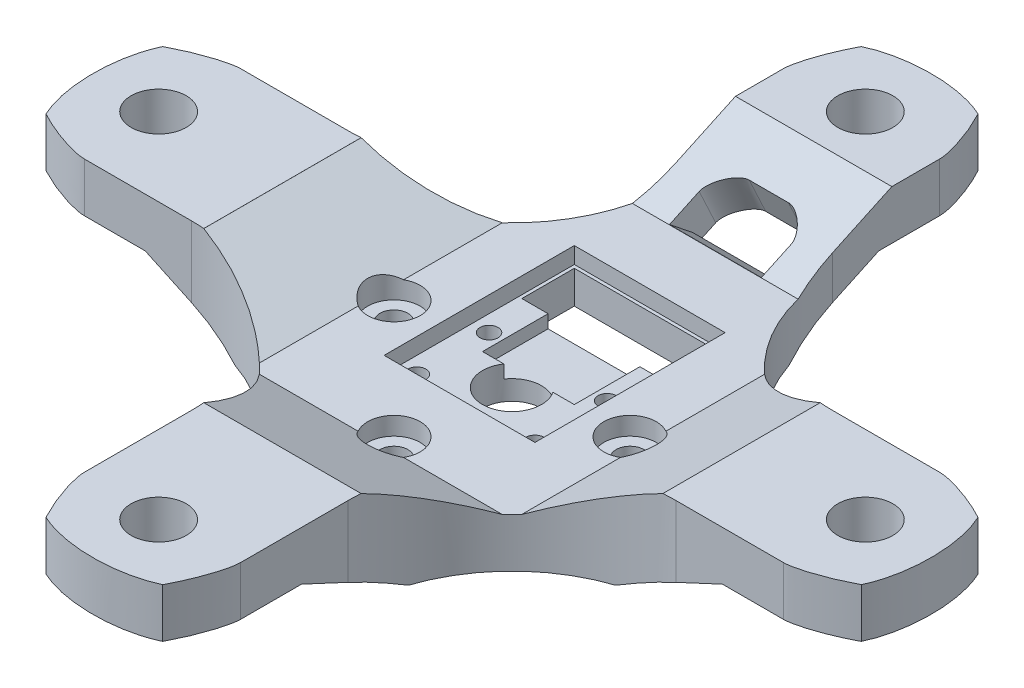
from build123d import *

# Parameters (mm, degrees)
BASE_PLATE_DEPTH                = 7.5
HOLE_PATTERN_R                  = 2.125
MOTOR_MOUNT_HOLES_DEPTH         = 102.876444775
SKETCH3_R                       = 1.375
SKETCH3_R_2                     = 4.5
ENCODER_MOUNTING_HOLES_DEPTH    = 102.876444775
SKETCH4_W                       = 22
SKETCH4_H                       = 8
ENCODER_WIRE_PASS_THROUGH_DEPTH = 5
CUT_EXTRUDE7_DEPTH              = 2
SKETCH10_W                      = 23
SKETCH10_H                      = 29
CUT_EXTRUDE9_DEPTH              = 2.5
SKETCH11_R                      = 4
CUT_EXTRUDE10_DEPTH             = 2.75
SKETCH18_W                      = 48
SKETCH18_H                      = 48
CUT_EXTRUDE12_DEPTH             = 102.876444775
BOSS_EXTRUDE3_DEPTH             = 7
CUT_EXTRUDE16_DEPTH             = 7
M8_CLEARANCE_HOLE1_D            = 8.4
FILLET2_R                       = 25
SKETCH22_W                      = 14
SKETCH22_H                      = 10
CUT_EXTRUDE13_DEPTH             = 2
FILLET7_SIZE                    = 16
CHAMFER1_SIZE                   = 15
CHAMFER1_SIZE2                  = 6.994614872
CHAMFER2_SIZE                   = 15
CHAMFER2_SIZE_2                 = 6.994614872
SKETCH28_W                      = 23.989880914
SKETCH28_H                      = 11
CUT_EXTRUDE18_DEPTH             = 7
CHAMFER5_SIZE2                  = 15.011548444
CHAMFER5_SIZE                   = 7
SKETCH30_W                      = 14
SKETCH30_H                      = 7
CUT_EXTRUDE19_DEPTH             = 7
CHAMFER6_SIZE                   = 4
CHAMFER6_SIZE2                  = 2
FILLET8_SIZE                    = 4


# Some blends are built 0.0001 mm under size
with BuildPart() as part:
    # Sketch1 → Base Plate (new body)
    with BuildSketch(Plane(origin=(0, 0, 0), x_dir=(1, 0, 0), z_dir=(0, 1, 0))):
        Polygon((0, 71.842048969), (71.842048969, 0), (0, -71.842048969), (-71.842048969, 0), align=None)
    extrude(amount=BASE_PLATE_DEPTH)

    # Hole Pattern → Motor Mount Holes (cut, through all)
    with BuildSketch(Plane.XZ):
        with Locations(Location((0, 18, 0), (0, 0, 270))):
            Circle(HOLE_PATTERN_R)
        with Locations(Location((18, 0, 0), (0, 0, 270))):
            Circle(HOLE_PATTERN_R)
        with Locations(Location((-18, 0, 0), (0, 0, 270))):
            Circle(HOLE_PATTERN_R)
    extrude(amount=-MOTOR_MOUNT_HOLES_DEPTH, mode=Mode.SUBTRACT)

    # Sketch3 → Encoder mounting holes (cut, through all)
    with BuildSketch(Plane(origin=(0, 7.5, 0), x_dir=(1, 0, 0), z_dir=(0, 1, 0))):
        with Locations(Location((-9, 5.5, 0), (0, 0, 270))):
            Circle(SKETCH3_R)
        with Locations(Location((9, 5.5, 0), (0, 0, 270))):
            Circle(SKETCH3_R)
        with Locations(Location((9, -5.5, 0), (0, 0, 270))):
            Circle(SKETCH3_R)
        with Locations(Location((-9, -5.5, 0), (0, 0, 270))):
            Circle(SKETCH3_R)
        with Locations(Location((0, 0, 0), (0, 0, 270))):
            Circle(SKETCH3_R_2)
    extrude(amount=-ENCODER_MOUNTING_HOLES_DEPTH, mode=Mode.SUBTRACT)

    # Sketch4 → Encoder Wire Pass through (cut)
    with BuildSketch(Plane(origin=(0, 0, 0), x_dir=(1, 0, 0), z_dir=(0, 1, 0))):
        with Locations((0, 16.5)):
            Rectangle(SKETCH4_W, SKETCH4_H)
    extrude(amount=ENCODER_WIRE_PASS_THROUGH_DEPTH, mode=Mode.SUBTRACT)

    # Sketch7 → Cut-Extrude7 (cut)
    with BuildSketch(Plane.XZ):
        Polygon((7.556624327, 3), (10.443375673, 3), (11.886751346, 5.5), (10.443375673, 8), (7.556624327, 8), (6.113248654, 5.5), align=None)
        Polygon((10.443375673, -8), (11.886751346, -5.5), (10.443375673, -3), (7.556624327, -3), (6.113248654, -5.5), (7.556624327, -8), align=None)
        Polygon((-7.556624327, -8), (-6.113248654, -5.5), (-7.556624327, -3), (-10.443375673, -3), (-11.886751346, -5.5), (-10.443375673, -8), align=None)
        Polygon((-7.556624327, 3), (-6.113248654, 5.5), (-7.556624327, 8), (-10.443375673, 8), (-11.886751346, 5.5), (-10.443375673, 3), align=None)
    extrude(amount=-CUT_EXTRUDE7_DEPTH, mode=Mode.SUBTRACT)

    # Sketch10 → Cut-Extrude9 (cut)
    with BuildSketch(Plane(origin=(0, 7.5, 0), x_dir=(1, 0, 0), z_dir=(0, 1, 0))):
        with Locations((0, 6.5)):
            Rectangle(SKETCH10_W, SKETCH10_H)
    extrude(amount=-CUT_EXTRUDE9_DEPTH, mode=Mode.SUBTRACT)

    # Sketch11 → Cut-Extrude10 (cut)
    with BuildSketch(Plane(origin=(0, 7.5, 0), x_dir=(1, 0, 0), z_dir=(0, 1, 0))):
        with Locations(Location((18, 0, 0), (0, 0, 270))):
            Circle(SKETCH11_R)
        with Locations(Location((0, -18, 0), (0, 0, 270))):
            Circle(SKETCH11_R)
        with Locations(Location((-18, 0, 0), (0, 0, 270))):
            Circle(SKETCH11_R)
    extrude(amount=-CUT_EXTRUDE10_DEPTH, mode=Mode.SUBTRACT)

    # Sketch18 → Cut-Extrude12 (cut, through all)
    with BuildSketch(Plane.XZ):
        with Locations((-35.921024484, -35.921024484)):
            Rectangle(SKETCH18_W, SKETCH18_H)
        with Locations((-35.921024484, 35.921024484)):
            Rectangle(SKETCH18_W, SKETCH18_H)
        with Locations((35.921024484, 35.921024484)):
            Rectangle(SKETCH18_W, SKETCH18_H)
        with Locations((35.921024484, -35.921024484)):
            Rectangle(SKETCH18_W, SKETCH18_H)
    extrude(amount=-CUT_EXTRUDE12_DEPTH, mode=Mode.SUBTRACT)

    # Sketch25 → Boss-Extrude3 (add)
    with BuildSketch(Plane(origin=(0, 7.5, 0), x_dir=(1, 0, 0), z_dir=(0, 1, 0))):
        Polygon((-11.921024484, 35), (11.921024484, 35), (11.921024484, 59.921024484), (0, 71.842048969), (-11.921024484, 59.921024484), align=None)
        Polygon((35, 11.921024484), (35, -11.921024484), (59.921024484, -11.921024484), (71.842048969, 0), (59.921024484, 11.921024484), align=None)
        Polygon((11.921024484, -35), (-11.921024484, -35), (-11.921024484, -59.921024484), (0, -71.842048969), (11.921024484, -59.921024484), align=None)
        Polygon((-35, -11.921024484), (-35, 11.921024484), (-59.921024484, 11.921024484), (-71.842048969, 0), (-59.921024484, -11.921024484), align=None)
    extrude(amount=BOSS_EXTRUDE3_DEPTH)

    # Sketch26 → Cut-Extrude16 (cut)
    with BuildSketch(Plane.XZ):
        Polygon((-11.921024484, 44), (11.921024484, 44), (11.921024484, 59.921024484), (0, 71.842048969), (-11.921024484, 59.921024484), align=None)
        Polygon((44, 11.921024484), (44, -11.921024484), (59.921024484, -11.921024484), (71.842048969, 0), (59.921024484, 11.921024484), align=None)
        Polygon((11.921024484, -44), (-11.921024484, -44), (-11.921024484, -59.921024484), (0, -71.842048969), (11.921024484, -59.921024484), align=None)
        Polygon((-44, -11.921024484), (-44, 11.921024484), (-59.921024484, 11.921024484), (-71.842048969, 0), (-59.921024484, -11.921024484), align=None)
    extrude(amount=-CUT_EXTRUDE16_DEPTH, mode=Mode.SUBTRACT)

    # M8 Clearance Hole1 (through all)
    with Locations(Plane(origin=(0, 0, 0), x_dir=(-1, 0, 0), z_dir=(0, -1, 0))):
        with Locations((53.881536726, 0), (0, -53.881536726), (-53.881536726, 0), (0, 53.881536726)):
            Hole(M8_CLEARANCE_HOLE1_D / 2)

    # Fillet2
    # the kernel refuses this fillet: 25 mm, written as the material it adds along each edge
    with BuildSketch(Plane(origin=(11.921024484, 0, -11.921024484), x_dir=(0, 0, -1), z_dir=(0, 1, 0))) as fillet2_piece_1_section:
        with BuildLine():
            CenterArc((FILLET2_R, -FILLET2_R), FILLET2_R, 90, 90)
            Line((0, -FILLET2_R), (0, 0))
            Line((0, 0), (FILLET2_R, 0))
        make_face()
    fillet2_piece_1 = extrude(amount=7.5, mode=Mode.PRIVATE)
    fillet2_piece_1 = split(fillet2_piece_1, bisect_by=Plane(origin=(11.921024484, 0, -35), z_dir=(0, 0, -1)), keep=Keep.TOP, mode=Mode.PRIVATE)
    add(fillet2_piece_1)
    with BuildSketch(Plane(origin=(11.921024484, 0, -11.921024484), x_dir=(0, 0, -1), z_dir=(0, 1, 0))) as fillet2_piece_2_section:
        with BuildLine():
            CenterArc((FILLET2_R, -FILLET2_R), FILLET2_R, 90, 90)
            Line((0, -FILLET2_R), (0, 0))
            Line((0, 0), (FILLET2_R, 0))
        make_face()
    fillet2_piece_2 = extrude(amount=7.5, mode=Mode.PRIVATE)
    fillet2_piece_2 = split(fillet2_piece_2, bisect_by=Plane(origin=(11.921024484, 0, -35), z_dir=(0, 0, 1)), keep=Keep.TOP, mode=Mode.PRIVATE)
    fillet2_piece_2 = split(fillet2_piece_2, bisect_by=Plane(origin=(35, 0, -11.921024484), z_dir=(-1, 0, 0)), keep=Keep.TOP, mode=Mode.PRIVATE)
    add(fillet2_piece_2)
    with BuildSketch(Plane(origin=(11.921024484, 0, -11.921024484), x_dir=(0, 0, -1), z_dir=(0, 1, 0))) as fillet2_piece_3_section:
        with BuildLine():
            CenterArc((FILLET2_R, -FILLET2_R), FILLET2_R, 90, 90)
            Line((0, -FILLET2_R), (0, 0))
            Line((0, 0), (FILLET2_R, 0))
        make_face()
    fillet2_piece_3 = extrude(amount=70, mode=Mode.PRIVATE)
    fillet2_piece_3 = split(fillet2_piece_3, bisect_by=Plane(origin=(11.921024484, 7.5, -11.921024484), z_dir=(0, 1, 0)), keep=Keep.TOP, mode=Mode.PRIVATE)
    fillet2_piece_3 = split(fillet2_piece_3, bisect_by=Plane(origin=(11.921024484, 0, -35), z_dir=(0, 0, -1)), keep=Keep.TOP, mode=Mode.PRIVATE)
    fillet2_piece_3 = split(fillet2_piece_3, bisect_by=Plane(origin=(11.921024484, 14.5, -11.921024484), z_dir=(0, -1, 0)), keep=Keep.TOP, mode=Mode.PRIVATE)
    add(fillet2_piece_3)
    with BuildSketch(Plane(origin=(11.921024484, 0, -11.921024484), x_dir=(0, 0, -1), z_dir=(0, 1, 0))) as fillet2_piece_4_section:
        with BuildLine():
            CenterArc((FILLET2_R, -FILLET2_R), FILLET2_R, 90, 90)
            Line((0, -FILLET2_R), (0, 0))
            Line((0, 0), (FILLET2_R, 0))
        make_face()
    fillet2_piece_4 = extrude(amount=7.5, mode=Mode.PRIVATE)
    fillet2_piece_4 = split(fillet2_piece_4, bisect_by=Plane(origin=(35, 0, -11.921024484), z_dir=(1, 0, 0)), keep=Keep.TOP, mode=Mode.PRIVATE)
    add(fillet2_piece_4)
    with BuildSketch(Plane(origin=(11.921024484, 0, -11.921024484), x_dir=(0, 0, -1), z_dir=(0, 1, 0))) as fillet2_piece_5_section:
        with BuildLine():
            CenterArc((FILLET2_R, -FILLET2_R), FILLET2_R, 90, 90)
            Line((0, -FILLET2_R), (0, 0))
            Line((0, 0), (FILLET2_R, 0))
        make_face()
    fillet2_piece_5 = extrude(amount=70, mode=Mode.PRIVATE)
    fillet2_piece_5 = split(fillet2_piece_5, bisect_by=Plane(origin=(11.921024484, 7.5, -11.921024484), z_dir=(0, 1, 0)), keep=Keep.TOP, mode=Mode.PRIVATE)
    fillet2_piece_5 = split(fillet2_piece_5, bisect_by=Plane(origin=(11.921024484, 14.5, -11.921024484), z_dir=(0, -1, 0)), keep=Keep.TOP, mode=Mode.PRIVATE)
    fillet2_piece_5 = split(fillet2_piece_5, bisect_by=Plane(origin=(35, 0, -11.921024484), z_dir=(1, 0, 0)), keep=Keep.TOP, mode=Mode.PRIVATE)
    add(fillet2_piece_5)
    with BuildSketch(Plane(origin=(11.921024484, 0, 11.921024484), x_dir=(0, 0, 1), z_dir=(0, 1, 0))) as fillet2_piece_6_section:
        with BuildLine():
            CenterArc((FILLET2_R, FILLET2_R), FILLET2_R, 180, 90)
            Line((0, FILLET2_R), (0, 0))
            Line((0, 0), (FILLET2_R, 0))
        make_face()
    fillet2_piece_6 = extrude(amount=7.5, mode=Mode.PRIVATE)
    fillet2_piece_6 = split(fillet2_piece_6, bisect_by=Plane(origin=(11.921024484, 0, 35), z_dir=(0, 0, 1)), keep=Keep.TOP, mode=Mode.PRIVATE)
    add(fillet2_piece_6)
    with BuildSketch(Plane(origin=(11.921024484, 0, 11.921024484), x_dir=(0, 0, 1), z_dir=(0, 1, 0))) as fillet2_piece_7_section:
        with BuildLine():
            CenterArc((FILLET2_R, FILLET2_R), FILLET2_R, 180, 90)
            Line((0, FILLET2_R), (0, 0))
            Line((0, 0), (FILLET2_R, 0))
        make_face()
    fillet2_piece_7 = extrude(amount=7.5, mode=Mode.PRIVATE)
    fillet2_piece_7 = split(fillet2_piece_7, bisect_by=Plane(origin=(11.921024484, 0, 35), z_dir=(0, 0, -1)), keep=Keep.TOP, mode=Mode.PRIVATE)
    fillet2_piece_7 = split(fillet2_piece_7, bisect_by=Plane(origin=(35, 0, 11.921024484), z_dir=(-1, 0, 0)), keep=Keep.TOP, mode=Mode.PRIVATE)
    add(fillet2_piece_7)
    with BuildSketch(Plane(origin=(11.921024484, 0, 11.921024484), x_dir=(0, 0, 1), z_dir=(0, 1, 0))) as fillet2_piece_8_section:
        with BuildLine():
            CenterArc((FILLET2_R, FILLET2_R), FILLET2_R, 180, 90)
            Line((0, FILLET2_R), (0, 0))
            Line((0, 0), (FILLET2_R, 0))
        make_face()
    fillet2_piece_8 = extrude(amount=70, mode=Mode.PRIVATE)
    fillet2_piece_8 = split(fillet2_piece_8, bisect_by=Plane(origin=(11.921024484, 7.5, 11.921024484), z_dir=(0, 1, 0)), keep=Keep.TOP, mode=Mode.PRIVATE)
    fillet2_piece_8 = split(fillet2_piece_8, bisect_by=Plane(origin=(11.921024484, 14.5, 11.921024484), z_dir=(0, -1, 0)), keep=Keep.TOP, mode=Mode.PRIVATE)
    fillet2_piece_8 = split(fillet2_piece_8, bisect_by=Plane(origin=(11.921024484, 0, 35), z_dir=(0, 0, 1)), keep=Keep.TOP, mode=Mode.PRIVATE)
    add(fillet2_piece_8)
    with BuildSketch(Plane(origin=(11.921024484, 0, 11.921024484), x_dir=(0, 0, 1), z_dir=(0, 1, 0))) as fillet2_piece_9_section:
        with BuildLine():
            CenterArc((FILLET2_R, FILLET2_R), FILLET2_R, 180, 90)
            Line((0, FILLET2_R), (0, 0))
            Line((0, 0), (FILLET2_R, 0))
        make_face()
    fillet2_piece_9 = extrude(amount=7.5, mode=Mode.PRIVATE)
    fillet2_piece_9 = split(fillet2_piece_9, bisect_by=Plane(origin=(35, 0, 11.921024484), z_dir=(1, 0, 0)), keep=Keep.TOP, mode=Mode.PRIVATE)
    add(fillet2_piece_9)
    with BuildSketch(Plane(origin=(11.921024484, 0, 11.921024484), x_dir=(0, 0, 1), z_dir=(0, 1, 0))) as fillet2_piece_10_section:
        with BuildLine():
            CenterArc((FILLET2_R, FILLET2_R), FILLET2_R, 180, 90)
            Line((0, FILLET2_R), (0, 0))
            Line((0, 0), (FILLET2_R, 0))
        make_face()
    fillet2_piece_10 = extrude(amount=70, mode=Mode.PRIVATE)
    fillet2_piece_10 = split(fillet2_piece_10, bisect_by=Plane(origin=(11.921024484, 7.5, 11.921024484), z_dir=(0, 1, 0)), keep=Keep.TOP, mode=Mode.PRIVATE)
    fillet2_piece_10 = split(fillet2_piece_10, bisect_by=Plane(origin=(11.921024484, 14.5, 11.921024484), z_dir=(0, -1, 0)), keep=Keep.TOP, mode=Mode.PRIVATE)
    fillet2_piece_10 = split(fillet2_piece_10, bisect_by=Plane(origin=(35, 0, 11.921024484), z_dir=(1, 0, 0)), keep=Keep.TOP, mode=Mode.PRIVATE)
    add(fillet2_piece_10)
    with BuildSketch(Plane(origin=(-11.921024484, 0, 11.921024484), x_dir=(-1, 0, 0), z_dir=(0, 1, 0))) as fillet2_piece_11_section:
        with BuildLine():
            CenterArc((FILLET2_R, FILLET2_R), FILLET2_R, 180, 90)
            Line((0, FILLET2_R), (0, 0))
            Line((0, 0), (FILLET2_R, 0))
        make_face()
    fillet2_piece_11 = extrude(amount=7.5, mode=Mode.PRIVATE)
    fillet2_piece_11 = split(fillet2_piece_11, bisect_by=Plane(origin=(-35, 0, 11.921024484), z_dir=(-1, 0, 0)), keep=Keep.TOP, mode=Mode.PRIVATE)
    add(fillet2_piece_11)
    with BuildSketch(Plane(origin=(-11.921024484, 0, 11.921024484), x_dir=(-1, 0, 0), z_dir=(0, 1, 0))) as fillet2_piece_12_section:
        with BuildLine():
            CenterArc((FILLET2_R, FILLET2_R), FILLET2_R, 180, 90)
            Line((0, FILLET2_R), (0, 0))
            Line((0, 0), (FILLET2_R, 0))
        make_face()
    fillet2_piece_12 = extrude(amount=7.5, mode=Mode.PRIVATE)
    fillet2_piece_12 = split(fillet2_piece_12, bisect_by=Plane(origin=(-35, 0, 11.921024484), z_dir=(1, 0, 0)), keep=Keep.TOP, mode=Mode.PRIVATE)
    fillet2_piece_12 = split(fillet2_piece_12, bisect_by=Plane(origin=(-11.921024484, 0, 35), z_dir=(0, 0, -1)), keep=Keep.TOP, mode=Mode.PRIVATE)
    add(fillet2_piece_12)
    with BuildSketch(Plane(origin=(-11.921024484, 0, 11.921024484), x_dir=(-1, 0, 0), z_dir=(0, 1, 0))) as fillet2_piece_13_section:
        with BuildLine():
            CenterArc((FILLET2_R, FILLET2_R), FILLET2_R, 180, 90)
            Line((0, FILLET2_R), (0, 0))
            Line((0, 0), (FILLET2_R, 0))
        make_face()
    fillet2_piece_13 = extrude(amount=70, mode=Mode.PRIVATE)
    fillet2_piece_13 = split(fillet2_piece_13, bisect_by=Plane(origin=(-11.921024484, 7.5, 11.921024484), z_dir=(0, 1, 0)), keep=Keep.TOP, mode=Mode.PRIVATE)
    fillet2_piece_13 = split(fillet2_piece_13, bisect_by=Plane(origin=(-11.921024484, 14.5, 11.921024484), z_dir=(0, -1, 0)), keep=Keep.TOP, mode=Mode.PRIVATE)
    fillet2_piece_13 = split(fillet2_piece_13, bisect_by=Plane(origin=(-35, 0, 11.921024484), z_dir=(-1, 0, 0)), keep=Keep.TOP, mode=Mode.PRIVATE)
    add(fillet2_piece_13)
    with BuildSketch(Plane(origin=(-11.921024484, 0, 11.921024484), x_dir=(-1, 0, 0), z_dir=(0, 1, 0))) as fillet2_piece_14_section:
        with BuildLine():
            CenterArc((FILLET2_R, FILLET2_R), FILLET2_R, 180, 90)
            Line((0, FILLET2_R), (0, 0))
            Line((0, 0), (FILLET2_R, 0))
        make_face()
    fillet2_piece_14 = extrude(amount=7.5, mode=Mode.PRIVATE)
    fillet2_piece_14 = split(fillet2_piece_14, bisect_by=Plane(origin=(-11.921024484, 0, 35), z_dir=(0, 0, 1)), keep=Keep.TOP, mode=Mode.PRIVATE)
    add(fillet2_piece_14)
    with BuildSketch(Plane(origin=(-11.921024484, 0, 11.921024484), x_dir=(-1, 0, 0), z_dir=(0, 1, 0))) as fillet2_piece_15_section:
        with BuildLine():
            CenterArc((FILLET2_R, FILLET2_R), FILLET2_R, 180, 90)
            Line((0, FILLET2_R), (0, 0))
            Line((0, 0), (FILLET2_R, 0))
        make_face()
    fillet2_piece_15 = extrude(amount=70, mode=Mode.PRIVATE)
    fillet2_piece_15 = split(fillet2_piece_15, bisect_by=Plane(origin=(-11.921024484, 7.5, 11.921024484), z_dir=(0, 1, 0)), keep=Keep.TOP, mode=Mode.PRIVATE)
    fillet2_piece_15 = split(fillet2_piece_15, bisect_by=Plane(origin=(-11.921024484, 14.5, 11.921024484), z_dir=(0, -1, 0)), keep=Keep.TOP, mode=Mode.PRIVATE)
    fillet2_piece_15 = split(fillet2_piece_15, bisect_by=Plane(origin=(-11.921024484, 0, 35), z_dir=(0, 0, 1)), keep=Keep.TOP, mode=Mode.PRIVATE)
    add(fillet2_piece_15)
    with BuildSketch(Plane(origin=(-11.921024484, 0, -11.921024484), x_dir=(0, 0, -1), z_dir=(0, 1, 0))) as fillet2_piece_16_section:
        with BuildLine():
            CenterArc((FILLET2_R, FILLET2_R), FILLET2_R, 180, 90)
            Line((0, FILLET2_R), (0, 0))
            Line((0, 0), (FILLET2_R, 0))
        make_face()
    fillet2_piece_16 = extrude(amount=7.5, mode=Mode.PRIVATE)
    fillet2_piece_16 = split(fillet2_piece_16, bisect_by=Plane(origin=(-11.921024484, 0, -35), z_dir=(0, 0, -1)), keep=Keep.TOP, mode=Mode.PRIVATE)
    add(fillet2_piece_16)
    with BuildSketch(Plane(origin=(-11.921024484, 0, -11.921024484), x_dir=(0, 0, -1), z_dir=(0, 1, 0))) as fillet2_piece_17_section:
        with BuildLine():
            CenterArc((FILLET2_R, FILLET2_R), FILLET2_R, 180, 90)
            Line((0, FILLET2_R), (0, 0))
            Line((0, 0), (FILLET2_R, 0))
        make_face()
    fillet2_piece_17 = extrude(amount=7.5, mode=Mode.PRIVATE)
    fillet2_piece_17 = split(fillet2_piece_17, bisect_by=Plane(origin=(-11.921024484, 0, -35), z_dir=(0, 0, 1)), keep=Keep.TOP, mode=Mode.PRIVATE)
    fillet2_piece_17 = split(fillet2_piece_17, bisect_by=Plane(origin=(-35, 0, -11.921024484), z_dir=(1, 0, 0)), keep=Keep.TOP, mode=Mode.PRIVATE)
    add(fillet2_piece_17)
    with BuildSketch(Plane(origin=(-11.921024484, 0, -11.921024484), x_dir=(0, 0, -1), z_dir=(0, 1, 0))) as fillet2_piece_18_section:
        with BuildLine():
            CenterArc((FILLET2_R, FILLET2_R), FILLET2_R, 180, 90)
            Line((0, FILLET2_R), (0, 0))
            Line((0, 0), (FILLET2_R, 0))
        make_face()
    fillet2_piece_18 = extrude(amount=70, mode=Mode.PRIVATE)
    fillet2_piece_18 = split(fillet2_piece_18, bisect_by=Plane(origin=(-11.921024484, 14.5, -11.921024484), z_dir=(0, -1, 0)), keep=Keep.TOP, mode=Mode.PRIVATE)
    fillet2_piece_18 = split(fillet2_piece_18, bisect_by=Plane(origin=(-11.921024484, 7.5, -11.921024484), z_dir=(0, 1, 0)), keep=Keep.TOP, mode=Mode.PRIVATE)
    fillet2_piece_18 = split(fillet2_piece_18, bisect_by=Plane(origin=(-11.921024484, 0, -35), z_dir=(0, 0, -1)), keep=Keep.TOP, mode=Mode.PRIVATE)
    add(fillet2_piece_18)
    with BuildSketch(Plane(origin=(-11.921024484, 0, -11.921024484), x_dir=(0, 0, -1), z_dir=(0, 1, 0))) as fillet2_piece_19_section:
        with BuildLine():
            CenterArc((FILLET2_R, FILLET2_R), FILLET2_R, 180, 90)
            Line((0, FILLET2_R), (0, 0))
            Line((0, 0), (FILLET2_R, 0))
        make_face()
    fillet2_piece_19 = extrude(amount=7.5, mode=Mode.PRIVATE)
    fillet2_piece_19 = split(fillet2_piece_19, bisect_by=Plane(origin=(-35, 0, -11.921024484), z_dir=(-1, 0, 0)), keep=Keep.TOP, mode=Mode.PRIVATE)
    add(fillet2_piece_19)
    with BuildSketch(Plane(origin=(-11.921024484, 0, -11.921024484), x_dir=(0, 0, -1), z_dir=(0, 1, 0))) as fillet2_piece_20_section:
        with BuildLine():
            CenterArc((FILLET2_R, FILLET2_R), FILLET2_R, 180, 90)
            Line((0, FILLET2_R), (0, 0))
            Line((0, 0), (FILLET2_R, 0))
        make_face()
    fillet2_piece_20 = extrude(amount=70, mode=Mode.PRIVATE)
    fillet2_piece_20 = split(fillet2_piece_20, bisect_by=Plane(origin=(-11.921024484, 14.5, -11.921024484), z_dir=(0, -1, 0)), keep=Keep.TOP, mode=Mode.PRIVATE)
    fillet2_piece_20 = split(fillet2_piece_20, bisect_by=Plane(origin=(-11.921024484, 7.5, -11.921024484), z_dir=(0, 1, 0)), keep=Keep.TOP, mode=Mode.PRIVATE)
    fillet2_piece_20 = split(fillet2_piece_20, bisect_by=Plane(origin=(-35, 0, -11.921024484), z_dir=(-1, 0, 0)), keep=Keep.TOP, mode=Mode.PRIVATE)
    add(fillet2_piece_20)

    # Sketch22 → Cut-Extrude13 (cut)
    with BuildSketch(Plane(origin=(0, 5, 0), x_dir=(1, 0, 0), z_dir=(0, 1, 0))):
        with Locations((0, 7.5)):
            Rectangle(SKETCH22_W, SKETCH22_H)
    extrude(amount=-CUT_EXTRUDE13_DEPTH, mode=Mode.SUBTRACT)

    # Fillet7
    # a fillet whose section is not a circle: 16 mm, written as the material it takes off along each edge
    with BuildSketch(Plane(origin=(11.921024484, 31.068542495, -59.921024484), x_dir=(-0.7071067811865509, 0, -0.7071067811865442), z_dir=(0, -1, 0)), Plane(origin=(-59.921024484, -9.568542495, -11.921024484), x_dir=(1, 0, 0), z_dir=(0, 1, 0)), Plane(origin=(-11.921024484, -9.568542495, 59.921024484), x_dir=(0, 0, -1), z_dir=(0, 1, 0)), Plane(origin=(59.921024484, -9.568542495, 11.921024484), x_dir=(-1, 0, 0), z_dir=(0, 1, 0))) as fillet7_piece_1:
        with BuildLine():
            Bezier((6.627416998, 0), (0, 0), (-4.686291501, -4.686291501), weights=[1, 0.428571429, 1])
            Line((-4.686291501, -4.686291501), (0, 0))
            Line((0, 0), (6.627416998, 0))
        make_face()
    extrude(amount=40.63708499, mode=Mode.SUBTRACT)
    with BuildSketch(Plane(origin=(0, -33, -71.842048969), x_dir=(-0.7071067811865493, 0, 0.7071067811865458), z_dir=(0, 1, 0)), Plane(origin=(0, -33, 71.842048969), x_dir=(0.7071067811864421, 3.444886432895443e-14, -0.7071067811866529), z_dir=(0, 1, 0)), Plane(origin=(71.842048969, -33, 0), x_dir=(-0.7071067811865911, 1.3256912175651027e-13, -0.7071067811865039), z_dir=(0, 1, 0))) as fillet7_piece_2:
        with BuildLine():
            Bezier((FILLET7_SIZE, 0), (0, 0), (0, FILLET7_SIZE), weights=[1, 0.428571429, 1])
            Line((0, FILLET7_SIZE), (0, 0))
            Line((0, 0), (FILLET7_SIZE, 0))
        make_face()
    extrude(amount=87.5, mode=Mode.SUBTRACT)
    with BuildSketch(Plane(origin=(-11.921024484, -9.568542495, -59.921024484), x_dir=(0, 0, 1), z_dir=(0, 1, 0)), Plane(origin=(-59.921024484, -9.568542495, 11.921024484), x_dir=(1, 0, 0), z_dir=(0, 1, 0)), Plane(origin=(11.921024484, -9.568542495, 59.921024484), x_dir=(0, 0, -1), z_dir=(0, 1, 0)), Plane(origin=(59.921024484, -9.568542495, -11.921024484), x_dir=(-1, 0, 0), z_dir=(0, 1, 0))) as fillet7_piece_3:
        with BuildLine():
            Bezier((6.627416998, 0), (0, 0), (-4.686291501, 4.686291501), weights=[1, 0.428571429, 1])
            Line((-4.686291501, 4.686291501), (0, 0))
            Line((0, 0), (6.627416998, 0))
        make_face()
    extrude(amount=40.63708499, mode=Mode.SUBTRACT)
    with BuildSketch(Plane(origin=(-71.842048969, -33, 0), x_dir=(0.7071067811865044, 1.3119175671805866e-13, -0.7071067811865906), z_dir=(0, 1, 0))) as fillet7_piece_4:
        with BuildLine():
            Bezier((FILLET7_SIZE, 0), (0, 0), (0, -FILLET7_SIZE), weights=[1, 0.428571429, 1])
            Line((0, -FILLET7_SIZE), (0, 0))
            Line((0, 0), (FILLET7_SIZE, 0))
        make_face()
    extrude(amount=87.5, mode=Mode.SUBTRACT)

    # Chamfer1
    chamfer1_edges = [part.edges().sort_by_distance(p)[0] for p in [
        (44, 0, 0),
        (0, 0, -44),
        (-44, 0, 0),
        (0, 0, 44),
    ]]
    chamfer1_side = [part.faces().sort_by_distance(p)[0] for p in [
        (-18.363354955, 0, -18.363354955),
    ]]
    chamfer(chamfer1_edges, length=CHAMFER1_SIZE, length2=CHAMFER1_SIZE2, reference=chamfer1_side[0])

    # Chamfer2
    # the kernel refuses this chamfer: 15, 6.994614872 mm, written as the material it adds along each edge
    with BuildSketch(Plane(origin=(35, 7.5, -50.859572528), x_dir=(-1, 0, 0), z_dir=(0, 0, 1))) as chamfer2_piece_1_section:
        Polygon((CHAMFER2_SIZE, 0), (0, -CHAMFER2_SIZE_2), (0, 0), align=None)
    chamfer2_piece_1 = extrude(amount=101.719145057, mode=Mode.PRIVATE)
    chamfer2_piece_1 = chamfer2_piece_1 - Plane(origin=(36.921024484, 7.5, -36.921024484), x_dir=(0, 0, -1), z_dir=(0, -1, 0)) * Cylinder(25, 264, mode=Mode.PRIVATE)
    chamfer2_piece_1 = chamfer2_piece_1 - Plane(origin=(36.921024484, 7.5, 36.921024484), x_dir=(0, 0, 1), z_dir=(0, -1, 0)) * Cylinder(25, 264, mode=Mode.PRIVATE)
    chamfer2_piece_1 = chamfer2_piece_1 - Plane(origin=(18, 7.5, 0), x_dir=(0, 0, 1), z_dir=(0, 1, 0)) * Cylinder(4, 264, mode=Mode.PRIVATE)
    add(chamfer2_piece_1)
    with BuildSketch(Plane(origin=(50.859572528, 7.5, 35), x_dir=(0, 0, -1), z_dir=(-1, 0, 0))) as chamfer2_piece_2_section:
        Polygon((CHAMFER2_SIZE, 0), (0, -CHAMFER2_SIZE_2), (0, 0), align=None)
    chamfer2_piece_2 = extrude(amount=101.719145057, mode=Mode.PRIVATE)
    chamfer2_piece_2 = chamfer2_piece_2 - Plane(origin=(36.921024484, 7.5, 36.921024484), x_dir=(0, 0, 1), z_dir=(0, -1, 0)) * Cylinder(25, 264, mode=Mode.PRIVATE)
    chamfer2_piece_2 = chamfer2_piece_2 - Plane(origin=(-36.921024484, 7.5, 36.921024484), x_dir=(-1, 0, 0), z_dir=(0, -1, 0)) * Cylinder(25, 264, mode=Mode.PRIVATE)
    chamfer2_piece_2 = chamfer2_piece_2 - Plane(origin=(0, 7.5, 18), x_dir=(0, 0, 1), z_dir=(0, 1, 0)) * Cylinder(4, 264, mode=Mode.PRIVATE)
    add(chamfer2_piece_2)
    with BuildSketch(Plane(origin=(-35, 7.5, 50.859572528), x_dir=(1, 0, 0), z_dir=(0, 0, -1))) as chamfer2_piece_3_section:
        Polygon((CHAMFER2_SIZE, 0), (0, -CHAMFER2_SIZE_2), (0, 0), align=None)
    chamfer2_piece_3 = extrude(amount=101.719145057, mode=Mode.PRIVATE)
    chamfer2_piece_3 = chamfer2_piece_3 - Plane(origin=(-36.921024484, 7.5, -36.921024484), x_dir=(0, 0, -1), z_dir=(0, -1, 0)) * Cylinder(25, 264, mode=Mode.PRIVATE)
    chamfer2_piece_3 = chamfer2_piece_3 - Plane(origin=(-36.921024484, 7.5, 36.921024484), x_dir=(-1, 0, 0), z_dir=(0, -1, 0)) * Cylinder(25, 264, mode=Mode.PRIVATE)
    chamfer2_piece_3 = chamfer2_piece_3 - Plane(origin=(-18, 7.5, 0), x_dir=(0, 0, 1), z_dir=(0, 1, 0)) * Cylinder(4, 264, mode=Mode.PRIVATE)
    add(chamfer2_piece_3)

    # Sketch28 → Cut-Extrude18 (cut)
    with BuildSketch(Plane(origin=(0, 14.5, 0), x_dir=(1, 0, 0), z_dir=(0, 1, 0))):
        with Locations((0, 40.5)):
            Rectangle(SKETCH28_W, SKETCH28_H)
    extrude(amount=-CUT_EXTRUDE18_DEPTH, mode=Mode.SUBTRACT)

    # Chamfer5
    chamfer5_edges = [part.edges().sort_by_distance(p)[0] for p in [
        (0, 7.5, -46),
    ]]
    chamfer5_side = [part.faces().sort_by_distance(p)[0] for p in [
        (0, 7.64, -46),
    ]]
    chamfer(chamfer5_edges, length=CHAMFER5_SIZE - 0.0001, length2=CHAMFER5_SIZE2 - 0.0001, reference=chamfer5_side[0])  # a hair under: the kernel refuses the full size

    # Sketch30 → Cut-Extrude19 (cut)
    with BuildSketch(Plane(origin=(0, -11.107644425, -5.17957966), x_dir=(1, 0, 0), z_dir=(0, -0.9063077870366509, -0.42261826174069755))):
        with Locations((0, -36.782925824)):
            Rectangle(SKETCH30_W, SKETCH30_H)
    extrude(amount=-CUT_EXTRUDE19_DEPTH, mode=Mode.SUBTRACT)

    # Chamfer6
    chamfer6_edges = [part.edges().sort_by_distance(p)[0] for p in [
        (0, 8.357116566, -32.826657978),
    ]]
    chamfer6_side = [part.faces().sort_by_distance(p)[0] for p in [
        (0, 5.657722199, -34.085406244),
    ]]
    chamfer(chamfer6_edges, length=CHAMFER6_SIZE, length2=CHAMFER6_SIZE2, reference=chamfer6_side[0])

    # Fillet8
    # a fillet whose section is not a circle: 4 mm, written as the material it adds along each edge
    with BuildSketch(Plane(origin=(7, 5.916655664, -41.688309019), x_dir=(-1, 0, 0), z_dir=(0, 0.9063077870366509, 0.42261826174069755))) as fillet8_piece_1_section:
        with BuildLine():
            Bezier((FILLET8_SIZE, 0), (0, 0), (0, FILLET8_SIZE), weights=[1, 0.428571429, 1])
            Line((0, FILLET8_SIZE), (0, 0))
            Line((0, 0), (FILLET8_SIZE, 0))
        make_face()
    fillet8_piece_1 = extrude(amount=15.956883836, mode=Mode.PRIVATE)
    fillet8_piece_1 = split(fillet8_piece_1, bisect_by=Plane(origin=(7, 11.315433223, -39.170836892), z_dir=(0, -0.9063090211894398, -0.42261561508141154)), keep=Keep.TOP, mode=Mode.PRIVATE)
    add(fillet8_piece_1)
    with BuildSketch(Plane(origin=(-7, 5.916655664, -41.688309019), x_dir=(1, 0, 0), z_dir=(0, 0.9063077870366509, 0.42261826174069755))) as fillet8_piece_2_section:
        with BuildLine():
            Bezier((FILLET8_SIZE, 0), (0, 0), (0, -FILLET8_SIZE), weights=[1, 0.428571429, 1])
            Line((0, -FILLET8_SIZE), (0, 0))
            Line((0, 0), (FILLET8_SIZE, 0))
        make_face()
    fillet8_piece_2 = extrude(amount=15.956883836, mode=Mode.PRIVATE)
    fillet8_piece_2 = split(fillet8_piece_2, bisect_by=Plane(origin=(-7, 11.315433223, -39.170836892), z_dir=(0, -0.9063090211894398, -0.42261561508141154)), keep=Keep.TOP, mode=Mode.PRIVATE)
    add(fillet8_piece_2)


solid = part.part
